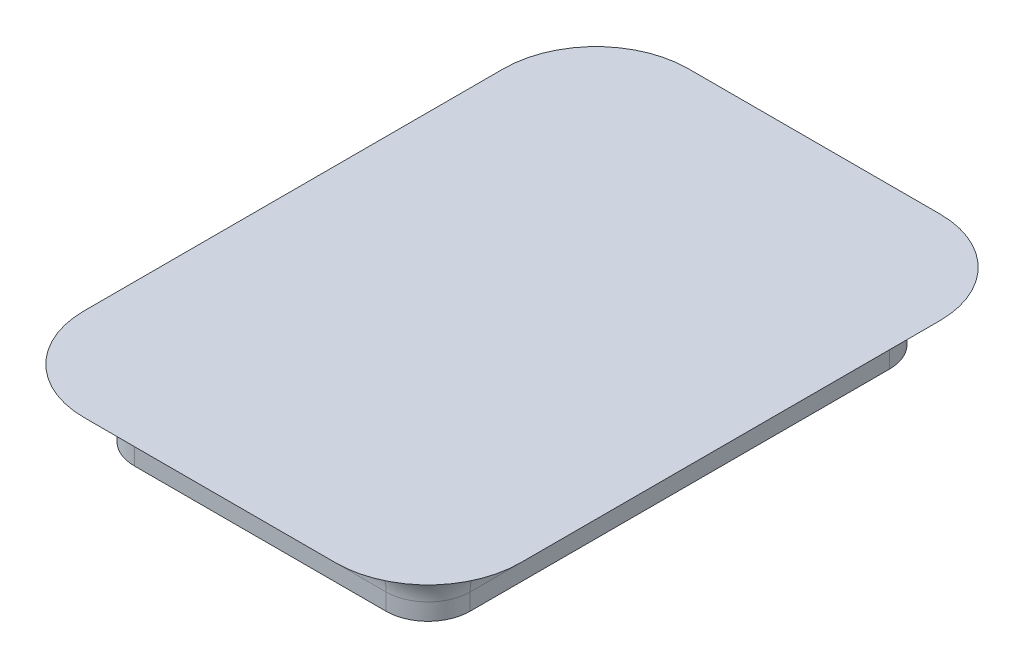
from build123d import *

# Parameters (mm, degrees)
SKETCH1_W           = 50
SKETCH1_H           = 5
BASE_EXTRUDE_DEPTH  = 25
SKETCH3_W           = 20
SKETCH3_H           = 4
BOSS_EXTRUDE1_DEPTH = 15
FILLET1_R           = 2.5
FILLET2_R           = 3
SKETCH4_W           = 50
SKETCH4_H           = 5
CUT_EXTRUDE1_DEPTH  = 57.124860802


with BuildPart() as part:
    # Sketch1 → Base-Extrude (new, symmetric)
    with BuildSketch(Plane.XY):
        with Locations((0, 2.5)):
            Rectangle(SKETCH1_W, SKETCH1_H)
    extrude(amount=BASE_EXTRUDE_DEPTH, both=True)

    # Sketch3 → Boss-Extrude1 (add, symmetric)
    with BuildSketch(Plane.XY):
        with Locations((0, -2)):
            Rectangle(SKETCH3_W, SKETCH3_H)
    extrude(amount=BOSS_EXTRUDE1_DEPTH, both=True)

    # Fillet1
    fillet1_edges = [part.edges().sort_by_distance(p)[0] for p in [
        (10, -2, 15),
        (-10, -2, 15),
        (-10, -2, -15),
        (10, -2, -15),
    ]]
    fillet(fillet1_edges, radius=FILLET1_R)

    # Fillet2
    fillet2_edges = [part.edges().sort_by_distance(p)[0] for p in [
        (-10, 0, 0),
        (-9.267766953, 0, 14.267766953),
        (-9.267766953, 0, -14.267766953),
        (0, 0, 15),
        (0, 0, -15),
        (9.267766953, 0, 14.267766953),
        (9.267766953, 0, -14.267766953),
        (10, 0, 0),
    ]]
    fillet(fillet2_edges, radius=FILLET2_R)

    # Sketch4 → Cut-Extrude1 (cut, through all)
    with BuildSketch(Plane(origin=(25, 0, 0), x_dir=(0, 0, -1), z_dir=(1, 0, 0))):
        with Locations((0, 2.5)):
            Rectangle(SKETCH4_W, SKETCH4_H)
    extrude(amount=-CUT_EXTRUDE1_DEPTH, mode=Mode.SUBTRACT)


solid = part.part
